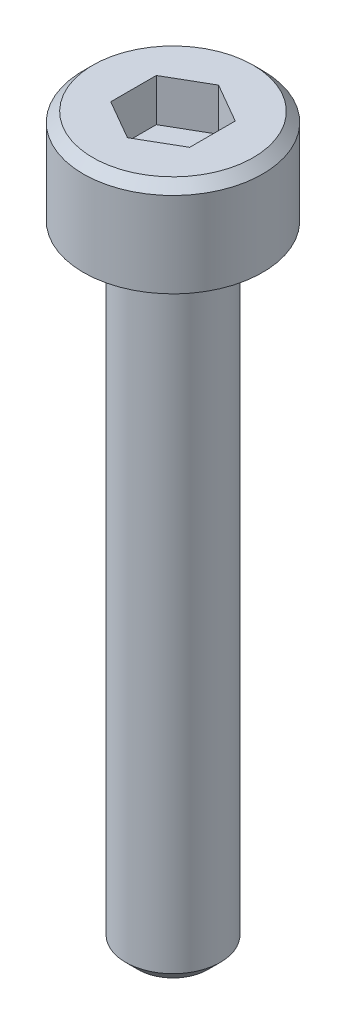
from build123d import *

# Parameters (mm, degrees)
CUT_EXTRUDE1_DEPTH = 1.35


with BuildPart() as part:
    # Sketch1 → Revolve1 (revolve)
    with BuildSketch(Plane.XY):
        Polygon((0, -20), (1.1, -20), (1.5, -19.6), (1.5, 0), (2.84, 0), (2.84, 2.7), (2.54, 3), (0, 3), align=None)
    revolve(axis=Axis((0, -10, 0), (0, 1, 0)))

    # Sketch2 → Cut-Extrude1 (cut)
    with BuildSketch(Plane(origin=(0, 3, 0), x_dir=(1, 0, 0), z_dir=(0, 1, 0))):
        Polygon((1.25, -0.721687836), (0, -1.443375673), (-1.25, -0.721687836), (-1.25, 0.721687836), (0, 1.443375673), (1.25, 0.721687836), align=None)
    extrude(amount=-CUT_EXTRUDE1_DEPTH, mode=Mode.SUBTRACT)


solid = part.part
